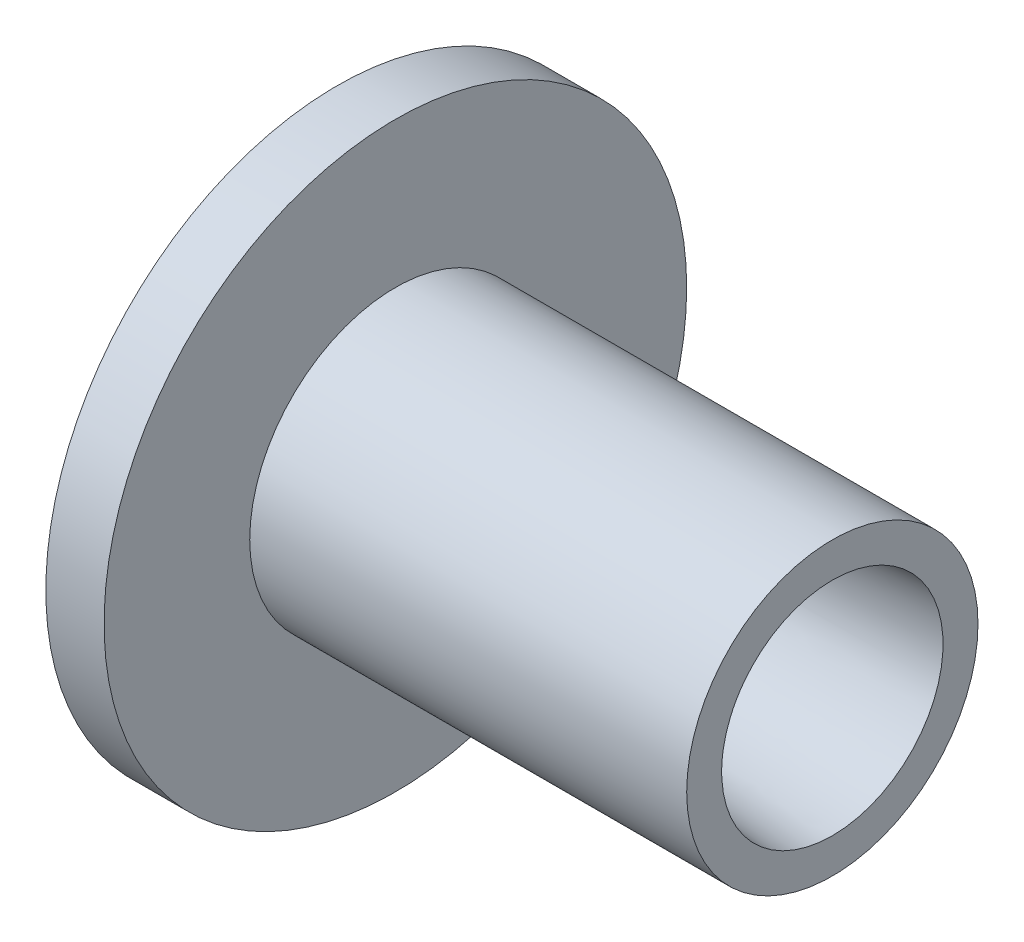
from build123d import *

# Parameters (mm, degrees)
SKETCH1_R           = 12.7
BOSS_EXTRUDE1_DEPTH = 2.54
SKETCH2_R           = 6.35
BOSS_EXTRUDE2_DEPTH = 19.05


with BuildPart() as part:
    # Sketch1 → Boss-Extrude1 (new body)
    with BuildSketch(Plane(origin=(0, 0, 0), x_dir=(0, 0, -1), z_dir=(1, 0, 0))):
        Circle(SKETCH1_R)
    extrude(amount=BOSS_EXTRUDE1_DEPTH)

    # Sketch2 → Boss-Extrude2 (add)
    with BuildSketch(Plane(origin=(2.54, 0, 0), x_dir=(0, 0, -1), z_dir=(1, 0, 0))):
        with Locations(Location((0, 0, 0), (0, 0, 180))):
            Circle(SKETCH2_R)
    extrude(amount=BOSS_EXTRUDE2_DEPTH)

    # Cut-Loft1: read off the stored shape, not the designer's step
    # Cut-Loft1: loft between two sections, ruled curve by curve
    cut_loft1_from = [
        Edge.make_bspline([(0, -0.087914937, -3.173782596), (0, 6.259650254, -3.34961247), (0, 6.435480128, 2.997952721), (0, 0.087914937, 3.173782596), (0, -6.259650254, 3.34961247), (0, -6.435480128, -2.997952721), (0, -0.087914937, -3.173782596)], [0, 0, 0, 0, 0.5, 0.5, 0.5, 1, 1, 1, 1], 3, [1, 0.333333333, 0.333333333, 1, 0.333333333, 0.333333333, 1]),
    ]
    cut_loft1_to = [
        Edge.make_bspline([(21.59, -1.385331043, -4.622892374), (21.59, 7.860453704, -7.393554461), (21.59, 10.631115791, 1.852230287), (21.59, 1.385331043, 4.622892374), (21.59, -7.860453704, 7.393554461), (21.59, -10.631115791, -1.852230287), (21.59, -1.385331043, -4.622892374)], [0, 0, 0, 0, 0.5, 0.5, 0.5, 1, 1, 1, 1], 3, [1, 0.333333333, 0.333333333, 1, 0.333333333, 0.333333333, 1]),
    ]
    cut_loft1 = Solid(Shell([*[Face.make_surface_from_curves(cut_loft1_from[k], cut_loft1_to[k]) for k in range(1)], Face(Wire(cut_loft1_from)), Face(Wire(cut_loft1_to))]))
    add(cut_loft1, mode=Mode.SUBTRACT)


solid = part.part
